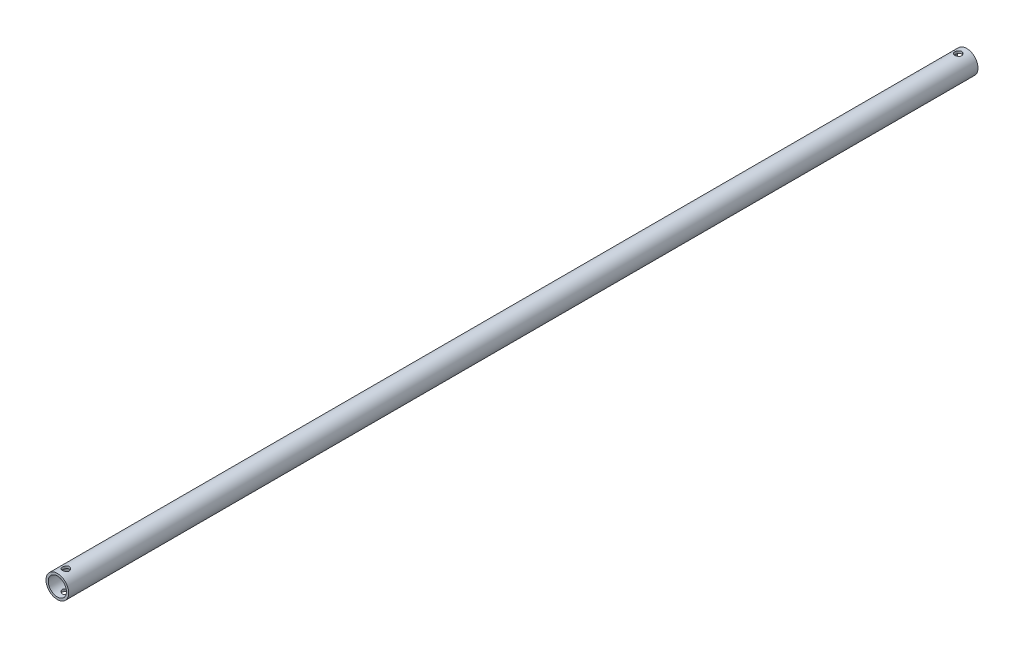
from build123d import *

# Parameters (mm, degrees)
SZKIC1_R                    = 10
DODANIE_WYCI_GNI_CIE2_DEPTH = 400
SZKIC3_R                    = 8
WYTNIJ_WYCI_GNI_CIE1_DEPTH  = 801.124990236
SZKIC4_R                    = 3
WYTNIJ_WYCI_GNI_CIE2_DEPTH  = 401.249921924


with BuildPart() as part:
    # Szkic1 → Dodanie-wyciągnięcie2 (new, symmetric)
    with BuildSketch(Plane.XY):
        Circle(SZKIC1_R)
    extrude(amount=DODANIE_WYCI_GNI_CIE2_DEPTH, both=True)

    # Szkic3 → Wytnij-wyciągnięcie1 (cut, through all)
    with BuildSketch(Plane.XY.offset(400)):
        Circle(SZKIC3_R)
    extrude(amount=-WYTNIJ_WYCI_GNI_CIE1_DEPTH, mode=Mode.SUBTRACT)

    # Szkic4 → Wytnij-wyciągnięcie2 (cut, symmetric)
    with BuildSketch(Plane(origin=(0, 0, 0), x_dir=(1, 0, 0), z_dir=(0, 1, 0))):
        with Locations((0, -392.5)):
            Circle(SZKIC4_R)
    wytnij_wyci_gni_cie2 = extrude(amount=WYTNIJ_WYCI_GNI_CIE2_DEPTH, both=True, mode=Mode.SUBTRACT)

    # Lustro1: Wytnij-wyciągnięcie2 across plane
    add(wytnij_wyci_gni_cie2.mirror(Plane(origin=(0, 0, 0), x_dir=(1, 0, 0), z_dir=(0, 0, -1))), mode=Mode.SUBTRACT)


solid = part.part
